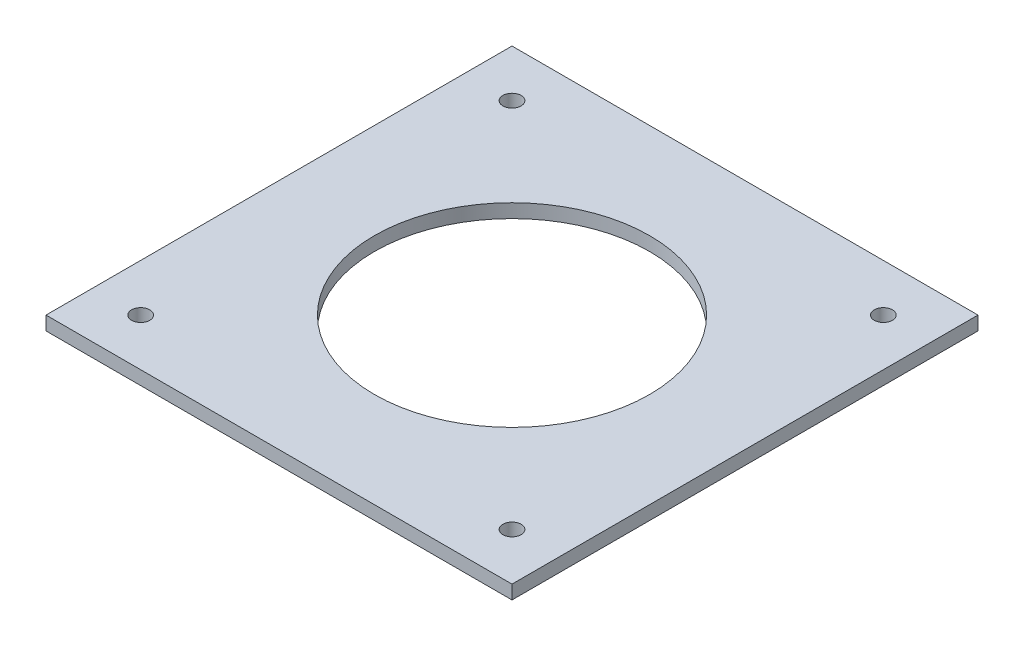
from build123d import *

# Parameters (mm, degrees)
SKETCH1_W           = 101.6
SKETCH1_H           = 101.6
SKETCH1_R           = 30
SKETCH1_R_2         = 1.985
BOSS_EXTRUDE1_DEPTH = 3


with BuildPart() as part:
    # Sketch1 → Boss-Extrude1 (new body)
    with BuildSketch(Plane(origin=(0, 0, 0), x_dir=(1, 0, 0), z_dir=(0, 1, 0))):
        Rectangle(SKETCH1_W, SKETCH1_H)
        Circle(SKETCH1_R, mode=Mode.SUBTRACT)
        with Locations((-40.48, 40.48)):
            Circle(SKETCH1_R_2, mode=Mode.SUBTRACT)
        with Locations((40.48, 40.48)):
            Circle(SKETCH1_R_2, mode=Mode.SUBTRACT)
        with Locations((40.48, -40.48)):
            Circle(SKETCH1_R_2, mode=Mode.SUBTRACT)
        with Locations((-40.48, -40.48)):
            Circle(SKETCH1_R_2, mode=Mode.SUBTRACT)
    extrude(amount=BOSS_EXTRUDE1_DEPTH)


solid = part.part
